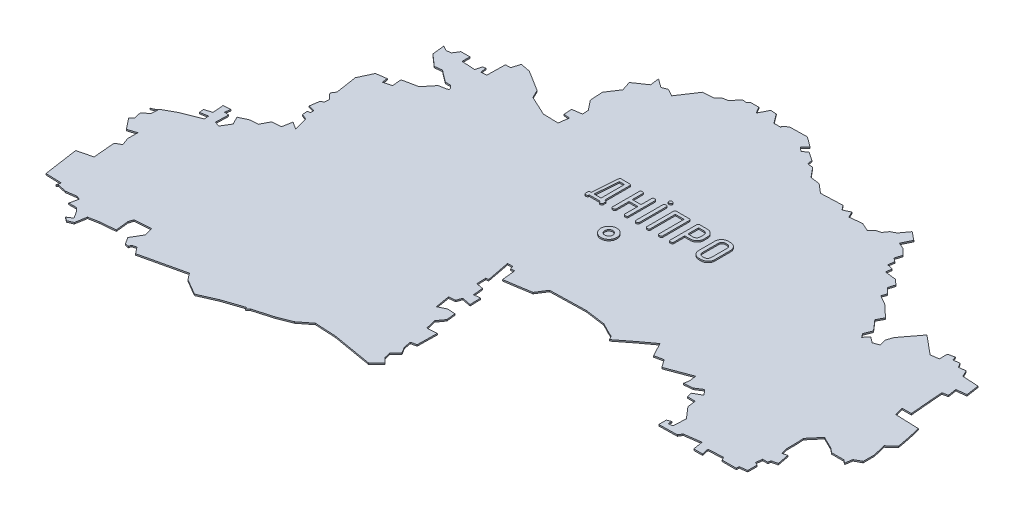
from build123d import *

# Parameters (mm, degrees)
EXTRUDE_4_DEPTH = 5
SKETCH_2_R      = 30
SKETCH_2_R_2    = 15
EXTRUDE_5_DEPTH = 10
SCALE_1_SCALE   = 0.05


with BuildPart() as part:
    # Эскиз1 → Бобышка-Вытянуть4 (new body)
    with BuildSketch(Plane(origin=(0, 0, 0), x_dir=(1, 0, 0), z_dir=(0, 1, 0))):
        with BuildLine():
            Line((2358.23506, -481.5078), (2348.5221, -465.28736))
            Line((2348.5221, -465.28736), (2324.4937, -467.88324))
            Line((2324.4937, -467.88324), (2319.32226, -454.24344))
            Line((2319.32226, -454.24344), (2295.29386, -459.4479))
            Line((2295.29386, -459.4479), (2295.29386, -489.94568))
            Line((2295.29386, -489.94568), (2264.80624, -493.85728))
            Line((2264.80624, -493.85728), (2194.68954, -435.44744))
            Line((2194.68954, -435.44744), (2141.4867, -505.52604))
            Line((2141.4867, -505.52604), (2133.05898, -530.83714))
            Line((2133.05898, -530.83714), (2140.19892, -554.8503))
            Line((2140.19892, -554.8503), (2118.14664, -563.27548))
            Line((2118.14664, -563.27548), (2095.41364, -546.40988))
            Line((2095.41364, -546.40988), (2080.51146, -565.24398))
            Line((2080.51146, -565.24398), (2070.1254, -551.58894))
            Line((2070.1254, -551.58894), (2081.78908, -522.38402))
            Line((2081.78908, -522.38402), (2048.03756, -483.46106))
            Line((2048.03756, -483.46106), (2061.69006, -457.50734))
            Line((2061.69006, -457.50734), (2016.87684, -415.31794))
            Line((2016.87684, -415.31794), (1981.21016, -394.56614))
            Line((1981.21016, -394.56614), (1988.36026, -375.7422))
            Line((1988.36026, -375.7422), (1967.5856, -354.95992))
            Line((1967.5856, -354.95992), (1974.7357, -331.61732))
            Line((1974.7357, -331.61732), (1955.90414, -314.0837))
            Line((1955.90414, -314.0837), (1913.06958, -308.9021))
            Line((1913.06958, -308.9021), (1916.3157, -286.83712))
            Line((1916.3157, -286.83712), (1894.23802, -281.6352))
            Line((1894.23802, -281.6352), (1897.4943, -258.2799))
            Line((1897.4943, -258.2799), (1883.89514, -247.90146))
            Line((1883.89514, -247.90146), (1892.30508, -221.93504))
            Line((1892.30508, -221.93504), (1868.94978, -199.88022))
            Line((1868.94978, -199.88022), (1846.24218, -189.50686))
            Line((1846.24218, -189.50686), (1863.78596, -153.80208))
            Line((1863.78596, -153.80208), (1832.58206, -128.49606))
            Line((1832.58206, -128.49606), (1809.23692, -160.93948))
            Line((1809.23692, -160.93948), (1790.41298, -170.67784))
            Line((1790.41298, -170.67784), (1778.04826, -188.19368))
            Line((1778.04826, -188.19368), (1759.29544, -193.39814))
            Line((1759.29544, -193.39814), (1744.36024, -208.31556))
            Line((1744.36024, -208.31556), (1713.19952, -194.68084))
            Line((1713.19952, -194.68084), (1667.14424, -199.88022))
            Line((1667.14424, -199.88022), (1656.73024, -177.80508))
            Line((1656.73024, -177.80508), (1631.40644, -189.50686))
            Line((1631.40644, -189.50686), (1617.80982, -172.62094))
            Line((1617.80982, -172.62094), (1537.32992, -175.84166))
            Line((1537.32992, -175.84166), (1503.60634, -147.32))
            Line((1503.60634, -147.32), (1467.89394, -142.1257))
            Line((1467.89394, -142.1257), (1438.70172, -106.43362))
            Line((1438.70172, -106.43362), (1417.94738, -104.46766))
            Line((1417.94738, -104.46766), (1414.6911, -85.67166))
            Line((1414.6911, -85.67166), (1382.20958, -63.61176))
            Line((1382.20958, -63.61176), (1365.37446, -77.22362))
            Line((1365.37446, -77.22362), (1349.79664, -63.61176))
            Line((1349.79664, -63.61176), (1366.67748, -44.79036))
            Line((1366.67748, -44.79036), (1329.65444, -17.51838))
            Line((1329.65444, -17.51838), (1264.78538, -18.83156))
            Line((1264.78538, -18.83156), (1247.28478, -31.79826))
            Line((1247.28478, -31.79826), (1249.21772, -36.34486))
            Line((1249.21772, -36.34486), (1223.24622, -36.34486))
            Line((1223.24622, -36.34486), (1197.93258, -1.95072))
            Line((1197.93258, -1.95072), (1175.88792, 0))
            Line((1175.88792, 0), (1157.06652, -36.34486))
            Line((1157.06652, -36.34486), (1143.42418, -12.34186))
            Line((1143.42418, -12.34186), (1112.91116, -12.34186))
            Line((1112.91116, -12.34186), (1102.54288, -20.7645))
            Line((1102.54288, -20.7645), (1088.91832, -18.83156))
            Line((1088.91832, -18.83156), (1064.89754, -48.02124))
            Line((1064.89754, -48.02124), (1044.16606, -51.25974))
            Line((1044.16606, -51.25974), (1029.25626, -66.8528))
            Line((1029.25626, -66.8528), (989.62464, -68.78828))
            Line((989.62464, -68.78828), (943.55412, -138.23188))
            Line((943.55412, -138.23188), (916.29484, -123.30684))
            Line((916.29484, -123.30684), (896.18566, -131.74218))
            Line((896.18566, -131.74218), (863.69652, -107.71886))
            Line((863.69652, -107.71886), (868.27106, -142.1257))
            Line((868.27106, -142.1257), (820.90514, -174.56404))
            Line((820.90514, -174.56404), (832.57136, -210.26628))
            Line((832.57136, -210.26628), (802.09136, -256.34696))
            Line((802.09136, -256.34696), (805.34764, -304.34788))
            Line((805.34764, -304.34788), (834.54748, -341.33536))
            Line((834.54748, -341.33536), (835.83272, -364.04804))
            Line((835.83272, -364.04804), (800.14064, -369.24234))
            Line((800.14064, -369.24234), (802.09136, -399.75028))
            Line((802.09136, -399.75028), (824.16142, -401.03298))
            Line((824.16142, -401.03298), (818.97982, -438.68086))
            Line((818.97982, -438.68086), (762.50546, -437.38038))
            Line((762.50546, -437.38038), (689.17566, -402.99386))
            Line((689.17566, -402.99386), (674.23792, -372.48846))
            Line((674.23792, -372.48846), (597.03208, -324.46976))
            Line((597.03208, -324.46976), (560.639888087, -317.514677457))
            Line((560.639888087, -317.514677457), (550.926, -348.48038))
            Line((550.926, -348.48038), (532.13762, -348.48038))
            Line((532.13762, -348.48038), (530.82444, -416.62096))
            Line((530.82444, -416.62096), (510.07772, -418.57168))
            Line((510.07772, -418.57168), (506.8316, -396.50416))
            Line((506.8316, -396.50416), (496.46078, -397.78686))
            Line((496.46078, -397.78686), (489.96092, -421.81018))
            Line((489.96092, -421.81018), (439.99404, -418.57168))
            Line((439.99404, -418.57168), (439.99404, -389.36422))
            Line((439.99404, -389.36422), (406.24252, -389.36422))
            Line((406.24252, -389.36422), (392.60272, -411.43174))
            Line((392.60272, -411.43174), (375.11736, -413.38246))
            Line((375.11736, -413.38246), (356.25278, -402.99386))
            Line((356.25278, -402.99386), (361.47502, -449.06692))
            Line((361.47502, -449.06692), (404.2918, -486.70972))
            Line((404.2918, -486.70972), (431.55108, -483.46106))
            Line((431.55108, -483.46106), (476.31858, -517.21766))
            Line((476.31858, -517.21766), (495.15776, -517.21766))
            add(Edge.make_bspline(
                [(495.15776, -517.21766), (518.50544, -534.73096), (495.15776, -537.96438)],
                knots=[0.34516129, 0.34516129, 0.34516129, 0.348387097, 0.348387097, 0.348387097], degree=2))
            add(Edge.make_bspline(
                [(495.15776, -537.96438), (471.13698, -541.24606), (472.44254, -543.18916)],
                knots=[0.348387097, 0.348387097, 0.348387097, 0.351612903, 0.351612903, 0.351612903], degree=2))
            Line((472.44254, -543.18916), (441.91936, -580.81672))
            Line((441.91936, -580.81672), (385.46024, -592.4804))
            Line((385.46024, -592.4804), (388.68858, -626.87454))
            Line((388.68858, -626.87454), (358.22128, -635.32766))
            Line((358.22128, -635.32766), (356.25278, -614.5403))
            Line((356.25278, -614.5403), (317.32982, -619.7346))
            Line((317.32982, -619.7346), (293.30904, -670.98164))
            Line((293.30904, -670.98164), (305.62042, -751.46916))
            Line((305.62042, -751.46916), (295.26992, -768.35508))
            Line((295.26992, -768.35508), (315.39688, -790.39974))
            Line((315.39688, -790.39974), (314.0837, -807.27042))
            Line((314.0837, -807.27042), (303.71288, -814.39512))
            Line((303.71288, -814.39512), (298.50588, -848.80958))
            Line((298.50588, -848.80958), (322.54444, -855.31706))
            Line((322.54444, -855.31706), (322.54444, -868.934))
            Line((322.54444, -868.934), (312.1406, -868.934))
            Line((312.1406, -868.934), (314.0837, -889.06096))
            Line((314.0837, -889.06096), (334.19034, -897.4963))
            Line((334.19034, -897.4963), (347.83522, -948.73826))
            Line((347.83522, -948.73826), (320.55054, -931.23004))
            Line((320.55054, -931.23004), (314.0837, -967.5876))
            Line((314.0837, -967.5876), (279.68448, -970.81594))
            Line((279.68448, -970.81594), (262.8392, -1003.23904))
            Line((262.8392, -1003.23904), (233.61396, -1004.5319))
            Line((233.61396, -1004.5319), (199.88784, -1020.1529))
            Line((199.88784, -1020.1529), (214.79002, -1049.32734))
            Line((214.79002, -1049.32734), (194.68084, -1083.05092))
            Line((194.68084, -1083.05092), (175.85944, -1076.58408))
            Line((175.85944, -1076.58408), (177.16246, -1028.56284))
            Line((177.16246, -1028.56284), (160.30194, -1027.27506))
            Line((160.30194, -1027.27506), (163.54806, -1006.51056))
            Line((163.54806, -1006.51056), (136.271, -1008.45366))
            Line((136.271, -1008.45366), (139.51712, -1049.32734))
            Line((139.51712, -1049.32734), (112.27816, -1057.79824))
            Line((112.27816, -1057.79824), (114.20348, -1074.65114))
            Line((114.20348, -1074.65114), (143.4211, -1069.46192))
            Line((143.4211, -1069.46192), (144.70634, -1086.97268))
            Line((144.70634, -1086.97268), (75.29068, -1114.2218))
            Line((75.29068, -1114.2218), (32.45612, -1138.23242))
            Line((32.45612, -1138.23242), (24.01062, -1146.66014))
            Line((24.01062, -1146.66014), (8.43534, -1153.16))
            Line((8.43534, -1153.16), (29.2354, -1144.74244))
            Line((29.2354, -1144.74244), (27.28468, -1168.72766))
            Line((27.28468, -1168.72766), (5.22478, -1187.55922))
            Line((5.22478, -1187.55922), (11.69924, -1214.79056))
            Line((11.69924, -1214.79056), (0, -1225.17662))
            Line((0, -1225.17662), (32.45612, -1266.06046))
            Line((32.45612, -1266.06046), (64.91224, -1255.66424))
            Line((64.91224, -1255.66424), (64.91224, -1293.33498))
            Line((64.91224, -1293.33498), (75.29068, -1322.54498))
            Line((75.29068, -1322.54498), (54.51602, -1334.19088))
            Line((54.51602, -1334.19088), (61.63818, -1415.9738))
            Line((61.63818, -1415.9738), (6.5024, -1429.61614))
            Line((6.5024, -1429.61614), (25.30602, -1559.3949))
            Line((25.30602, -1559.3949), (85.01126, -1561.32022))
            Line((85.01126, -1561.32022), (80.69707328, -1577.319718575))
            Line((80.69707328, -1577.319718575), (85.01126, -1573.02962))
            Line((85.01126, -1573.02962), (119.41048, -1580.17972))
            Line((119.41048, -1580.17972), (157.03804, -1574.97272))
            Line((157.03804, -1574.97272), (170.6626, -1580.17972))
            Line((170.6626, -1580.17972), (163.54806, -1612.61806))
            Line((163.54806, -1612.61806), (192.7479, -1612.61806))
            Line((192.7479, -1612.61806), (208.35112, -1629.47858))
            Line((208.35112, -1629.47858), (221.94774, -1651.54864))
            Line((221.94774, -1651.54864), (203.14412, -1663.9032))
            Line((203.14412, -1663.9032), (216.76868, -1673.60092))
            Line((216.76868, -1673.60092), (236.86008, -1665.16304))
            Line((236.86008, -1665.16304), (243.98986, -1622.98634))
            Line((243.98986, -1622.98634), (281.64536, -1615.85402))
            Line((281.64536, -1615.85402), (339.42528, -1610.68258))
            Line((339.42528, -1610.68258), (334.19034, -1562.64102))
            Line((334.19034, -1562.64102), (339.42528, -1544.47748))
            Line((339.42528, -1544.47748), (401.04568, -1540.53794))
            Line((401.04568, -1540.53794), (409.4734, -1573.02962))
            Line((409.4734, -1573.02962), (385.46024, -1613.9033))
            Line((385.46024, -1613.9033), (401.04568, -1637.9063))
            Line((401.04568, -1637.9063), (414.65246, -1641.1702))
            Line((414.65246, -1641.1702), (417.93414, -1631.41152))
            Line((417.93414, -1631.41152), (433.48402, -1627.55326))
            Line((433.48402, -1627.55326), (452.2978, -1651.54864))
            Line((452.2978, -1651.54864), (615.86364, -1613.9033))
            Line((615.86364, -1613.9033), (634.68504, -1637.9063))
            Line((634.68504, -1637.9063), (693.0517, -1672.33092))
            Line((693.0517, -1672.33092), (759.27712, -1643.06758))
            Line((759.27712, -1643.06758), (834.54748, -1617.8403))
            Line((834.54748, -1617.8403), (835.90885806, -1624.245126426))
            Line((835.90885806, -1624.245126426), (846.21116, -1615.85402))
            Line((846.21116, -1615.85402), (918.25572, -1595.08952))
            Line((918.25572, -1595.08952), (969.50784, -1574.97272))
            Line((969.50784, -1574.97272), (1013.61748, -1540.53794))
            Line((1013.61748, -1540.53794), (1092.18222, -1544.47748))
            Line((1092.18222, -1544.47748), (1240.7646, -1569.7835))
            Line((1240.7646, -1569.7835), (1273.24612, -1539.2781))
            Line((1273.24612, -1539.2781), (1254.40694, -1520.4567))
            Line((1254.40694, -1520.4567), (1249.21772, -1498.40442))
            Line((1249.21772, -1498.40442), (1271.27762, -1474.40142))
            Line((1271.27762, -1474.40142), (1257.63782, -1452.32374))
            Line((1257.63782, -1452.32374), (1252.45622, -1424.4193))
            Line((1252.45622, -1424.4193), (1273.24612, -1419.87778))
            Line((1273.24612, -1419.87778), (1274.52374, -1345.9079))
            Line((1274.52374, -1345.9079), (1237.52864, -1347.851))
            Line((1237.52864, -1347.851), (1228.44306, -1308.88486))
            Line((1228.44306, -1308.88486), (1247.28478, -1282.94892))
            Line((1247.28478, -1282.94892), (1245.95382, -1269.33198))
            Line((1245.95382, -1269.33198), (1243.99548, -1249.20756))
            Line((1243.99548, -1249.20756), (1214.81088, -1247.28224))
            Line((1214.81088, -1247.28224), (1186.25874, -1260.87124))
            Line((1186.25874, -1260.87124), (1177.1757, -1206.373))
            Line((1177.1757, -1206.373), (1201.1787, -1204.44006))
            Line((1201.1787, -1204.44006), (1208.31102, -1184.30294))
            Line((1208.31102, -1184.30294), (1242.07778, -1190.80534))
            Line((1242.07778, -1190.80534), (1240.7646, -1149.91388))
            Line((1240.7646, -1149.91388), (1216.74636, -1153.16))
            Line((1216.74636, -1153.16), (1213.51548, -1115.5426))
            Line((1213.51548, -1115.5426), (1187.57192, -1110.9833))
            Line((1187.57192, -1110.9833), (1186.25874, -1076.58408))
            Line((1186.25874, -1076.58408), (1195.97932, -1074.65114))
            Line((1195.97932, -1074.65114), (1179.1188, -987.68916))
            Line((1179.1188, -987.68916), (1197.93258, -987.68916))
            Line((1197.93258, -987.68916), (1203.12942, -1000.00816))
            Line((1203.12942, -1000.00816), (1216.74636, -998.06506))
            Line((1216.74636, -998.06506), (1221.93558, -1049.32734))
            Line((1221.93558, -1049.32734), (1269.3269, -1042.19502))
            Line((1269.3269, -1042.19502), (1320.57902, -1033.75968))
            Line((1320.57902, -1033.75968), (1344.57186, -996.11434))
            Line((1344.57186, -996.11434), (1479.5754, -992.86822))
            Line((1479.5754, -992.86822), (1554.84068, -1003.23904))
            Line((1554.84068, -1003.23904), (1587.31204, -1020.1529))
            Line((1587.31204, -1020.1529), (1609.3821, -1030.52118))
            Line((1609.3821, -1030.52118), (1615.86672, -1044.14574))
            Line((1615.86672, -1044.14574), (1672.33346, -1000.00816))
            Line((1672.33346, -1000.00816), (1723.57796, -962.36282))
            Line((1723.57796, -962.36282), (1750.85248, -1013.65812))
            Line((1750.85248, -1013.65812), (1783.24764, -1006.51056))
            Line((1783.24764, -1006.51056), (1804.06294, -1035.72056))
            Line((1804.06294, -1035.72056), (1896.19128, -1001.30356))
            Line((1896.19128, -1001.30356), (1899.44502, -1027.27506))
            Line((1899.44502, -1027.27506), (1896.19128, -1047.37408))
            Line((1896.19128, -1047.37408), (1929.98344, -1044.14574))
            Line((1929.98344, -1044.14574), (1955.90414, -1027.27506))
            Line((1955.90414, -1027.27506), (1972.75704, -1047.37408))
            Line((1972.75704, -1047.37408), (1942.2618, -1064.88484))
            Line((1942.2618, -1064.88484), (1947.4688, -1083.05092))
            Line((1947.4688, -1083.05092), (1976.02094, -1083.05092))
            Line((1976.02094, -1083.05092), (1979.92492, -1114.2218))
            Line((1979.92492, -1114.2218), (2016.87684, -1157.05382))
            Line((2016.87684, -1157.05382), (2013.64088, -1204.44006))
            Line((2013.64088, -1204.44006), (1998.10878, -1206.373))
            Line((1998.10878, -1206.373), (1998.10878, -1192.74844))
            Line((1998.10878, -1192.74844), (1983.15326, -1197.91988))
            Line((1983.15326, -1197.91988), (1983.15326, -1226.47202))
            Line((1983.15326, -1226.47202), (2051.31162, -1225.17662))
            Line((2051.31162, -1225.17662), (2059.74696, -1211.56984))
            Line((2059.74696, -1211.56984), (2121.36736, -1203.1345))
            Line((2121.36736, -1203.1345), (2127.87738, -1240.12452))
            Line((2127.87738, -1240.12452), (2160.3335, -1240.12452))
            Line((2160.3335, -1240.12452), (2155.10872, -1214.79056))
            Line((2155.10872, -1214.79056), (2210.29784, -1211.56984))
            Line((2210.29784, -1211.56984), (2216.77484, -1223.25384))
            Line((2216.77484, -1223.25384), (2270.02086, -1223.25384))
            Line((2270.02086, -1223.25384), (2270.02086, -1212.85762))
            Line((2270.02086, -1212.85762), (2298.53998, -1208.9892))
            Line((2298.53998, -1208.9892), (2298.53998, -1173.95244))
            Line((2298.53998, -1173.95244), (2286.86614, -1168.72766))
            Line((2286.86614, -1168.72766), (2290.10464, -1144.74244))
            Line((2290.10464, -1144.74244), (2308.90826, -1144.74244))
            Line((2308.90826, -1144.74244), (2310.85136, -1134.34622))
            Line((2310.85136, -1134.34622), (2332.94682, -1129.14938))
            Line((2332.94682, -1129.14938), (2324.4937, -1085.02958))
            Line((2324.4937, -1085.02958), (2306.97532, -1090.2188))
            Line((2306.97532, -1090.2188), (2300.52626, -1064.88484))
            Line((2300.52626, -1064.88484), (2300.52626, -1030.52118))
            Line((2300.52626, -1030.52118), (2298.53998, -1001.30356))
            Line((2298.53998, -1001.30356), (2334.87214, -958.47154))
            Line((2334.87214, -958.47154), (2380.95282, -981.1766))
            Line((2380.95282, -981.1766), (2397.80572, -994.81894))
            Line((2397.80572, -994.81894), (2443.8864, -994.81894))
            Line((2443.8864, -994.81894), (2455.62882, -1004.5319))
            Line((2455.62882, -1004.5319), (2459.48962, -977.28278))
            Line((2459.48962, -977.28278), (2484.77786, -963.68616))
            Line((2484.77786, -963.68616), (2484.77786, -921.4993))
            Line((2484.77786, -921.4993), (2473.13196, -874.12322))
            Line((2473.13196, -874.12322), (2501.6587, -848.80958))
            Line((2501.6587, -848.80958), (2491.9178, -797.54222))
            Line((2491.9178, -797.54222), (2481.55714, -754.71528))
            Line((2481.55714, -754.71528), (2394.56722, -751.46916))
            Line((2394.56722, -751.46916), (2385.49434, -719.03082))
            Line((2385.49434, -719.03082), (2419.92658, -719.03082))
            Line((2419.92658, -719.03082), (2413.41656, -643.72998))
            Line((2413.41656, -643.72998), (2409.51512, -594.41842))
            Line((2409.51512, -594.41842), (2430.26184, -590.54746))
            Line((2430.26184, -590.54746), (2425.07262, -558.09134))
            Line((2425.07262, -558.09134), (2462.7078, -553.54474))
            Line((2462.7078, -553.54474), (2455.62882, -505.52604))
            Line((2455.62882, -505.52604), (2395.89056, -502.26722))
            Line((2395.89056, -502.26722), (2384.21672, -478.23374))
            Line((2384.21672, -478.23374), (2358.23506, -481.5078))
        make_face()
    extrude(amount=EXTRUDE_4_DEPTH)

    # Эскиз2 → Бобышка-Вытянуть5 (add)
    # profile 1 of 8: a face of its own
    with BuildSketch(Plane(origin=(0, 0, 0), x_dir=(1, 0, 0), z_dir=(0, 1, 0))):
        with Locations((1274.370708345, -704.402905574)):
            Circle(SKETCH_2_R)
        with Locations((1274.370708345, -704.402905574)):
            Circle(SKETCH_2_R_2, mode=Mode.SUBTRACT)
    # profile 2 of 8: a face of its own
    with BuildSketch(Plane(origin=(0, 0, 0), x_dir=(1, 0, 0), z_dir=(0, 1, 0))):
        with BuildLine():
            add(Edge.make_bspline(
                [(1168.34409001, -619.015856633), (1168.320924518, -619.428047826), (1168.277376409, -620.202913584), (1167.974758725, -621.299724988), (1167.426392999, -622.223951417), (1166.665076071, -622.99275006), (1165.662730078, -623.55058371), (1164.478515906, -623.967179941), (1163.071531143, -624.185001608), (1162.073612619, -624.221971393), (1161.538769064, -624.241785687)],
                knots=[0, 0, 0, 0, 1.011223658, 1.900968769, 2.761019817, 3.620651225, 4.523080298, 5.550410921, 6.687120342, 8, 8, 8, 8], degree=3))
            add(Edge.make_bspline(
                [(1161.538769064, -624.241785687), (1161.127425316, -624.230246119), (1160.352878561, -624.208517493), (1159.269804198, -624.001431894), (1158.343054939, -623.657551317), (1157.576154908, -623.162167793), (1156.969703803, -622.512224857), (1156.551636803, -621.709637221), (1156.323660825, -620.769957738), (1156.286196981, -620.10873379), (1156.266387308, -619.759099876)],
                knots=[0, 0, 0, 0, 1.24640066, 2.346931468, 3.328022477, 4.226704364, 5.090670078, 5.993941009, 6.939260654, 8, 8, 8, 8], degree=3))
            Line((1156.266387308, -619.759099876), (1156.266387308, -618.295839741))
            Line((1156.266387308, -618.295839741), (1114.575086632, -618.295839741))
            Line((1114.575086632, -618.295839741), (1114.575086632, -619.759099876))
            add(Edge.make_bspline(
                [(1114.575086632, -619.759099876), (1114.55136682, -620.109751645), (1114.506110383, -620.778780977), (1114.197843605, -621.729363726), (1113.652515931, -622.535717179), (1112.868555123, -623.184676414), (1111.876437799, -623.658340413), (1110.685394413, -624.007896954), (1109.286111379, -624.207576435), (1108.281398313, -624.229901134), (1107.746539335, -624.241785687)],
                knots=[0, 0, 0, 0, 0.90963295, 1.735542724, 2.560229832, 3.401392929, 4.344787885, 5.393539172, 6.612450636, 8, 8, 8, 8], degree=3))
            add(Edge.make_bspline(
                [(1107.746539335, -624.241785687), (1107.327846618, -624.221021397), (1106.537596952, -624.181830429), (1105.424601014, -623.971281424), (1104.498423134, -623.537186921), (1103.717103171, -622.964565876), (1103.104488967, -622.208272071), (1102.685897464, -621.280036754), (1102.459950536, -620.195495778), (1102.42382494, -619.427267511), (1102.404478524, -619.015856633)],
                knots=[0, 0, 0, 0, 1.175256394, 2.218204275, 3.15048955, 4.018671257, 4.913572477, 5.845857752, 6.846387733, 8, 8, 8, 8], degree=3))
            Line((1102.404478524, -619.015856633), (1102.404478524, -611.629876903))
            add(Edge.make_bspline(
                [(1102.404478524, -611.629876903), (1102.42382494, -611.218466025), (1102.459950536, -610.450237757), (1102.685897464, -609.365696782), (1103.104488967, -608.437461464), (1103.717103171, -607.68116766), (1104.498423134, -607.108546615), (1105.424601014, -606.674452111), (1106.537596952, -606.463903107), (1107.327846618, -606.424712138), (1107.746539335, -606.403947849)],
                knots=[0, 0, 0, 0, 1.153612267, 2.154142248, 3.086427523, 3.981328743, 4.84951045, 5.781795725, 6.824743606, 8, 8, 8, 8], degree=3))
            Line((1107.746539335, -606.403947849), (1110.440796091, -606.403947849))
            Line((1110.440796091, -606.403947849), (1117.80354947, -511.733339741))
            add(Edge.make_bspline(
                [(1117.80354947, -511.733339741), (1117.855992817, -511.344885718), (1117.954961763, -510.611811127), (1118.241727105, -509.583416212), (1118.727060833, -508.738258873), (1119.307066054, -508.005465572), (1120.081711375, -507.471960584), (1120.969895249, -507.074650303), (1122.003161444, -506.836128881), (1122.733949055, -506.818645944), (1123.122383929, -506.809353254)],
                knots=[0, 0, 0, 0, 1.153876531, 2.177548735, 3.116003306, 4.005891104, 4.903911204, 5.852547225, 6.858566379, 8, 8, 8, 8], degree=3))
            Line((1123.122383929, -506.809353254), (1153.990204875, -506.809353254))
            add(Edge.make_bspline(
                [(1153.990204875, -506.809353254), (1154.517252466, -506.829709246), (1155.507312864, -506.867948035), (1156.899800559, -507.081072123), (1158.08002374, -507.502005954), (1159.063147081, -508.077166271), (1159.815316088, -508.86082195), (1160.35658906, -509.799198649), (1160.658943589, -510.918252411), (1160.702628152, -511.708282081), (1160.725846767, -512.128187714)],
                knots=[0, 0, 0, 0, 1.29179243, 2.42663575, 3.434416577, 4.345091539, 5.190008446, 6.065035692, 6.971554559, 8, 8, 8, 8], degree=3))
            Line((1160.725846767, -512.128187714), (1160.725846767, -606.403947849))
            Line((1160.725846767, -606.403947849), (1161.538769064, -606.403947849))
            add(Edge.make_bspline(
                [(1161.538769064, -606.403947849), (1162.073612619, -606.423762143), (1163.071531143, -606.460731927), (1164.478515906, -606.678553594), (1165.662730078, -607.095149825), (1166.665076071, -607.652983476), (1167.426392999, -608.421782119), (1167.974758725, -609.346008548), (1168.277376409, -610.442819951), (1168.320924518, -611.217685709), (1168.34409001, -611.629876903)],
                knots=[0, 0, 0, 0, 1.312879658, 2.449589079, 3.476919702, 4.379348775, 5.238980183, 6.099031231, 6.988776342, 8, 8, 8, 8], degree=3))
            Line((1168.34409001, -611.629876903), (1168.34409001, -619.015856633))
        make_face()
        Polygon((1147.347468389, -606.403947849), (1147.347468389, -518.701245146), (1128.185728524, -518.701245146), (1121.264275821, -606.403947849), align=None, mode=Mode.SUBTRACT)
    # profile 3 of 8: a face of its own
    with BuildSketch(Plane(origin=(0, 0, 0), x_dir=(1, 0, 0), z_dir=(0, 1, 0))):
        with BuildLine():
            Line((1243.374495416, -552.890434335), (1243.374495416, -513.498542443))
            add(Edge.make_bspline(
                [(1243.374495416, -513.498542443), (1243.388904396, -513.086038984), (1243.415939029, -512.312085596), (1243.706598262, -511.230981208), (1244.161326911, -510.301883054), (1244.850264708, -509.55991652), (1245.698067594, -508.960411471), (1246.75778437, -508.585137745), (1247.975069982, -508.314383167), (1248.854066138, -508.30226785), (1249.320441362, -508.295839741)],
                knots=[0, 0, 0, 0, 1.091529518, 2.047965782, 2.948064081, 3.805939007, 4.706037306, 5.674741692, 6.76627121, 8, 8, 8, 8], degree=3))
            add(Edge.make_bspline(
                [(1249.320441362, -508.295839741), (1249.901676865, -508.316139073), (1250.991853018, -508.354212879), (1252.521291219, -508.566784576), (1253.819280698, -508.983253143), (1254.893876217, -509.564062487), (1255.748463652, -510.326879892), (1256.330810396, -511.282694639), (1256.699538667, -512.396329729), (1256.734432653, -513.193419695), (1256.752873794, -513.6146742)],
                knots=[0, 0, 0, 0, 1.342902474, 2.518772933, 3.553495682, 4.473922706, 5.321854953, 6.165250748, 7.030352379, 8, 8, 8, 8], degree=3))
            Line((1256.752873794, -513.6146742), (1256.752873794, -612.977005281))
            add(Edge.make_bspline(
                [(1256.752873794, -612.977005281), (1256.734432653, -613.398259787), (1256.699538667, -614.195349753), (1256.330810396, -615.308984842), (1255.748463652, -616.264799589), (1254.893876217, -617.027616994), (1253.819280698, -617.608426339), (1252.521291219, -618.024894906), (1250.991853018, -618.237466602), (1249.901676865, -618.275540408), (1249.320441362, -618.295839741)],
                knots=[0, 0, 0, 0, 0.969647621, 1.834749252, 2.678145047, 3.526077294, 4.446504318, 5.481227067, 6.657097526, 8, 8, 8, 8], degree=3))
            add(Edge.make_bspline(
                [(1249.320441362, -618.295839741), (1248.855182938, -618.27556219), (1247.980221613, -618.237428387), (1246.748463429, -618.02215062), (1245.704518928, -617.599980457), (1244.84131511, -617.010587429), (1244.161858898, -616.239827602), (1243.706253558, -615.29067631), (1243.416239462, -614.186151707), (1243.389000176, -613.397146125), (1243.374495416, -612.977005281)],
                knots=[0, 0, 0, 0, 1.22289028, 2.299757822, 3.266537475, 4.157864275, 5.022578284, 5.932048079, 6.898827733, 8, 8, 8, 8], degree=3))
            Line((1243.374495416, -612.977005281), (1243.374495416, -564.782326227))
            Line((1243.374495416, -564.782326227), (1210.671792713, -564.782326227))
            Line((1210.671792713, -564.782326227), (1210.671792713, -612.977005281))
            add(Edge.make_bspline(
                [(1210.671792713, -612.977005281), (1210.653351572, -613.398259787), (1210.618457586, -614.195349753), (1210.249729314, -615.308984842), (1209.667382571, -616.264799589), (1208.812795136, -617.027616994), (1207.738199617, -617.608426339), (1206.440210138, -618.024894906), (1204.910771937, -618.237466602), (1203.820595784, -618.275540408), (1203.239360281, -618.295839741)],
                knots=[0, 0, 0, 0, 0.969647621, 1.834749252, 2.678145047, 3.526077294, 4.446504318, 5.481227067, 6.657097526, 8, 8, 8, 8], degree=3))
            add(Edge.make_bspline(
                [(1203.239360281, -618.295839741), (1202.774101857, -618.27556219), (1201.899140532, -618.237428387), (1200.667382348, -618.02215062), (1199.623437847, -617.599980457), (1198.760234029, -617.010587429), (1198.080777817, -616.239827602), (1197.625172477, -615.29067631), (1197.335158381, -614.186151707), (1197.307919095, -613.397146125), (1197.293414335, -612.977005281)],
                knots=[0, 0, 0, 0, 1.22289028, 2.299757822, 3.266537475, 4.157864275, 5.022578284, 5.932048079, 6.898827733, 8, 8, 8, 8], degree=3))
            Line((1197.293414335, -612.977005281), (1197.293414335, -513.6146742))
            add(Edge.make_bspline(
                [(1197.293414335, -513.6146742), (1197.307919095, -513.194533356), (1197.335158381, -512.405527774), (1197.625172477, -511.301003172), (1198.080777817, -510.351851879), (1198.760234029, -509.581092053), (1199.623437847, -508.991699025), (1200.667382348, -508.569528862), (1201.899140532, -508.354251094), (1202.774101857, -508.316117292), (1203.239360281, -508.295839741)],
                knots=[0, 0, 0, 0, 1.101172267, 2.067951921, 2.977421716, 3.842135725, 4.733462525, 5.700242178, 6.77710972, 8, 8, 8, 8], degree=3))
            add(Edge.make_bspline(
                [(1203.239360281, -508.295839741), (1203.821544391, -508.302077641), (1204.91505322, -508.313794207), (1206.432333119, -508.583517153), (1207.743829354, -508.951162798), (1208.804122958, -509.544592302), (1209.666888839, -510.277027819), (1210.249164233, -511.212303904), (1210.618733306, -512.302714434), (1210.653439585, -513.084908254), (1210.671792713, -513.498542443)],
                knots=[0, 0, 0, 0, 1.353106154, 2.541521659, 3.579288285, 4.507284885, 5.350131461, 6.185231121, 7.040326791, 8, 8, 8, 8], degree=3))
            Line((1210.671792713, -513.498542443), (1210.671792713, -552.890434335))
            Line((1210.671792713, -552.890434335), (1243.374495416, -552.890434335))
        make_face()
    # profile 4 of 8: a face of its own
    with BuildSketch(Plane(origin=(0, 0, 0), x_dir=(1, 0, 0), z_dir=(0, 1, 0))):
        with BuildLine():
            add(Edge.make_bspline(
                [(1297.779900821, -612.95377893), (1297.759936522, -613.37446623), (1297.721810091, -614.177865614), (1297.369779113, -615.299245601), (1296.767551433, -616.245258116), (1295.915763636, -617.001641993), (1294.853637046, -617.614129881), (1293.547142474, -618.022695067), (1292.019240976, -618.238141894), (1290.928829406, -618.275775242), (1290.347468389, -618.295839741)],
                knots=[0, 0, 0, 0, 0.968349646, 1.849286893, 2.676465977, 3.523263178, 4.451261044, 5.484598709, 6.658895142, 8, 8, 8, 8], degree=3))
            add(Edge.make_bspline(
                [(1290.347468389, -618.295839741), (1289.882082892, -618.275747936), (1289.006882594, -618.237963446), (1287.776699981, -618.020382626), (1286.72343905, -617.604028466), (1285.874497328, -616.985518224), (1285.195512908, -616.221941514), (1284.722999636, -615.279097552), (1284.447396918, -614.169295918), (1284.417363968, -613.373525277), (1284.401522443, -612.95377893)],
                knots=[0, 0, 0, 0, 1.220860227, 2.29594012, 3.261114875, 4.162696787, 5.025975332, 5.915822489, 6.900655729, 8, 8, 8, 8], degree=3))
            Line((1284.401522443, -612.95377893), (1284.401522443, -512.941110011))
            add(Edge.make_bspline(
                [(1284.401522443, -512.941110011), (1284.41753976, -512.521531969), (1284.447905983, -511.726080405), (1284.721279484, -510.614144505), (1285.20391666, -509.673155262), (1285.858670003, -508.883903504), (1286.732952094, -508.296004815), (1287.775054982, -507.872398792), (1289.00738043, -507.657563307), (1289.882255716, -507.619362422), (1290.347468389, -507.5990492)],
                knots=[0, 0, 0, 0, 1.098843442, 2.08322802, 2.972669788, 3.850929026, 4.740370794, 5.705105844, 6.779695961, 8, 8, 8, 8], degree=3))
            add(Edge.make_bspline(
                [(1290.347468389, -507.5990492), (1290.928645311, -507.619404934), (1292.018711589, -507.657584528), (1293.548867011, -507.869465687), (1294.844598809, -508.288107937), (1295.93103761, -508.86452598), (1296.759470331, -509.651291811), (1297.371243632, -510.593914258), (1297.721390728, -511.717518446), (1297.759792398, -512.520592871), (1297.779900821, -512.941110011)],
                knots=[0, 0, 0, 0, 1.340544031, 2.514349394, 3.547254935, 4.466065479, 5.324653274, 6.151486447, 7.032055301, 8, 8, 8, 8], degree=3))
            Line((1297.779900821, -512.941110011), (1297.779900821, -612.95377893))
        make_face()
    # profile 5 of 8: a face of its own
    with BuildSketch(Plane(origin=(0, 0, 0), x_dir=(1, 0, 0), z_dir=(0, 1, 0))):
        with BuildLine():
            add(Edge.make_bspline(
                [(1290.347468389, -484.512055957), (1290.928703892, -484.532355289), (1292.018880045, -484.570429096), (1293.548318246, -484.783000792), (1294.846307725, -485.199469359), (1295.920903244, -485.780278704), (1296.775490679, -486.543096108), (1297.357837423, -487.498910855), (1297.726565694, -488.612545945), (1297.76145968, -489.409635911), (1297.779900821, -489.830890416)],
                knots=[0, 0, 0, 0, 1.342902474, 2.518772933, 3.553495682, 4.473922706, 5.321854953, 6.165250748, 7.030352379, 8, 8, 8, 8], degree=3))
            add(Edge.make_bspline(
                [(1297.779900821, -489.830890416), (1297.76094014, -490.259518152), (1297.725041373, -491.071050536), (1297.364742866, -492.204807854), (1296.767780039, -493.164870061), (1295.929963191, -493.952927733), (1294.845169023, -494.53210674), (1293.546446931, -494.94227415), (1292.021438636, -495.193104952), (1290.929164152, -495.225420493), (1290.347468389, -495.242630281)],
                knots=[0, 0, 0, 0, 0.981339183, 1.857995784, 2.696169867, 3.550943068, 4.465671455, 5.493987931, 6.665411832, 8, 8, 8, 8], degree=3))
            add(Edge.make_bspline(
                [(1290.347468389, -495.242630281), (1289.881631081, -495.225369499), (1289.004047875, -495.192852196), (1287.777992924, -494.939496375), (1286.732391145, -494.524216455), (1285.859523505, -493.933746521), (1285.196557176, -493.141463375), (1284.727200438, -492.185707557), (1284.444762196, -491.062210324), (1284.416538146, -490.258486167), (1284.401522443, -489.830890416)],
                knots=[0, 0, 0, 0, 1.213876563, 2.286801999, 3.246455683, 4.131212664, 5.004846013, 5.90761226, 6.886811976, 8, 8, 8, 8], degree=3))
            add(Edge.make_bspline(
                [(1284.401522443, -489.830890416), (1284.416027203, -489.410749572), (1284.443266489, -488.62174399), (1284.733280585, -487.517219388), (1285.188885925, -486.568068095), (1285.868342137, -485.797308269), (1286.731545955, -485.207915241), (1287.775490456, -484.785745078), (1289.00724864, -484.57046731), (1289.882209965, -484.532333508), (1290.347468389, -484.512055957)],
                knots=[0, 0, 0, 0, 1.101172267, 2.067951921, 2.977421716, 3.842135725, 4.733462525, 5.700242178, 6.77710972, 8, 8, 8, 8], degree=3))
        make_face()
    # profile 6 of 8: a face of its own
    with BuildSketch(Plane(origin=(0, 0, 0), x_dir=(1, 0, 0), z_dir=(0, 1, 0))):
        with BuildLine():
            add(Edge.make_bspline(
                [(1384.888008929, -612.977005281), (1384.869567788, -613.398259787), (1384.834673802, -614.195349753), (1384.465945531, -615.308984842), (1383.883598787, -616.264799589), (1383.029011352, -617.027616994), (1381.954415833, -617.608426339), (1380.656426354, -618.024894906), (1379.126988153, -618.237466602), (1378.036812, -618.275540408), (1377.455576497, -618.295839741)],
                knots=[0, 0, 0, 0, 0.969647621, 1.834749252, 2.678145047, 3.526077294, 4.446504318, 5.481227067, 6.657097526, 8, 8, 8, 8], degree=3))
            add(Edge.make_bspline(
                [(1377.455576497, -618.295839741), (1376.990286278, -618.275592908), (1376.11526516, -618.237516874), (1374.883901201, -618.021858234), (1373.838676856, -617.600924564), (1372.984548004, -617.010709318), (1372.297020867, -616.265888393), (1371.836913205, -615.331213339), (1371.554130083, -614.23990912), (1371.525004761, -613.458933359), (1371.509630551, -613.046684335)],
                knots=[0, 0, 0, 0, 1.231142298, 2.315276502, 3.288579949, 4.185921389, 5.041168779, 5.938510218, 6.911813665, 8, 8, 8, 8], degree=3))
            Line((1371.509630551, -613.046684335), (1371.509630551, -520.187731633))
            Line((1371.509630551, -520.187731633), (1338.806927848, -520.187731633))
            Line((1338.806927848, -520.187731633), (1338.806927848, -613.046684335))
            add(Edge.make_bspline(
                [(1338.806927848, -613.046684335), (1338.787445394, -613.459958067), (1338.750255962, -614.248843043), (1338.390105549, -615.350542284), (1337.801396765, -616.290769654), (1336.9399634, -617.02588992), (1335.874403166, -617.609755025), (1334.575002185, -618.02446824), (1333.046012391, -618.237597577), (1331.955767544, -618.275585955), (1331.374495416, -618.295839741)],
                knots=[0, 0, 0, 0, 0.957214147, 1.827195396, 2.6601552, 3.500842069, 4.426460774, 5.467019893, 6.649522866, 8, 8, 8, 8], degree=3))
            add(Edge.make_bspline(
                [(1331.374495416, -618.295839741), (1330.909236992, -618.27556219), (1330.034275667, -618.237428387), (1328.802517483, -618.02215062), (1327.758572982, -617.599980457), (1326.895369164, -617.010587429), (1326.215912952, -616.239827602), (1325.760307612, -615.29067631), (1325.470293516, -614.186151707), (1325.44305423, -613.397146125), (1325.42854947, -612.977005281)],
                knots=[0, 0, 0, 0, 1.22289028, 2.299757822, 3.266537475, 4.157864275, 5.022578284, 5.932048079, 6.898827733, 8, 8, 8, 8], degree=3))
            Line((1325.42854947, -612.977005281), (1325.42854947, -513.6146742))
            add(Edge.make_bspline(
                [(1325.42854947, -513.6146742), (1325.444931412, -513.194875522), (1325.475622587, -512.408392746), (1325.739587801, -511.307853057), (1326.146059883, -510.364585147), (1326.749406986, -509.583473878), (1327.540989126, -508.998605478), (1328.489788743, -508.571693061), (1329.615256116, -508.353001185), (1330.413652492, -508.315747102), (1330.840289335, -508.295839741)],
                knots=[0, 0, 0, 0, 1.157077194, 2.167756429, 3.10506564, 3.97280776, 4.857486845, 5.794796055, 6.821611322, 8, 8, 8, 8], degree=3))
            Line((1330.840289335, -508.295839741), (1377.989782578, -508.295839741))
            add(Edge.make_bspline(
                [(1377.989782578, -508.295839741), (1378.532346732, -508.315864885), (1379.545612864, -508.353262859), (1380.968284322, -508.567903372), (1382.172046155, -508.988244179), (1383.174987176, -509.564153732), (1383.957038449, -510.338644576), (1384.48820069, -511.29071672), (1384.829523921, -512.399850149), (1384.867748333, -513.193830299), (1384.888008929, -513.6146742)],
                knots=[0, 0, 0, 0, 1.311732788, 2.449727646, 3.461545579, 4.37596936, 5.222620336, 6.085851813, 6.985418475, 8, 8, 8, 8], degree=3))
            Line((1384.888008929, -513.6146742), (1384.888008929, -612.977005281))
        make_face()
    # profile 7 of 8: a face of its own
    with BuildSketch(Plane(origin=(0, 0, 0), x_dir=(1, 0, 0), z_dir=(0, 1, 0))):
        with BuildLine():
            Line((1425.915035956, -572.21475866), (1425.915035956, -612.977005281))
            add(Edge.make_bspline(
                [(1425.915035956, -612.977005281), (1425.896594815, -613.398259787), (1425.861700829, -614.195349753), (1425.492972558, -615.308984842), (1424.910625814, -616.264799589), (1424.056038379, -617.027616994), (1422.98144286, -617.608426339), (1421.683453381, -618.024894906), (1420.15401518, -618.237466602), (1419.063839027, -618.275540408), (1418.482603524, -618.295839741)],
                knots=[0, 0, 0, 0, 0.969647621, 1.834749252, 2.678145047, 3.526077294, 4.446504318, 5.481227067, 6.657097526, 8, 8, 8, 8], degree=3))
            add(Edge.make_bspline(
                [(1418.482603524, -618.295839741), (1418.0173451, -618.27556219), (1417.142383775, -618.237428387), (1415.910625592, -618.02215062), (1414.86668109, -617.599980457), (1414.003477272, -617.010587429), (1413.32402106, -616.239827602), (1412.86841572, -615.29067631), (1412.578401624, -614.186151707), (1412.551162338, -613.397146125), (1412.536657578, -612.977005281)],
                knots=[0, 0, 0, 0, 1.22289028, 2.299757822, 3.266537475, 4.157864275, 5.022578284, 5.932048079, 6.898827733, 8, 8, 8, 8], degree=3))
            Line((1412.536657578, -612.977005281), (1412.536657578, -513.6146742))
            add(Edge.make_bspline(
                [(1412.536657578, -513.6146742), (1412.55303952, -513.194875522), (1412.583730695, -512.408392746), (1412.84769591, -511.307853057), (1413.254167991, -510.364585147), (1413.857515094, -509.583473878), (1414.649097234, -508.998605478), (1415.597896851, -508.571693061), (1416.723364224, -508.353001185), (1417.5217606, -508.315747102), (1417.948397443, -508.295839741)],
                knots=[0, 0, 0, 0, 1.157077194, 2.167756429, 3.10506564, 3.97280776, 4.857486845, 5.794796055, 6.821611322, 8, 8, 8, 8], degree=3))
            Line((1417.948397443, -508.295839741), (1445.40194474, -508.295839741))
            add(Edge.make_bspline(
                [(1445.40194474, -508.295839741), (1446.332399132, -508.315979763), (1448.153631215, -508.355400991), (1450.823284413, -508.729370465), (1453.385638775, -509.257188511), (1455.814165583, -510.102516476), (1458.154158399, -511.099366142), (1460.339258915, -512.412282824), (1462.44523023, -513.882693427), (1464.37023343, -515.609556666), (1466.155447815, -517.444969908), (1467.709586974, -519.391201146), (1469.026747503, -521.416259401), (1470.126019715, -523.500674195), (1470.972376338, -525.674497989), (1471.540912095, -527.931076678), (1471.93751865, -530.246307337), (1471.976529862, -531.822458442), (1471.996117037, -532.613829606)],
                knots=[0, 0, 0, 0, 1.115359705, 2.183157925, 3.228715987, 4.24774915, 5.262329495, 6.273717254, 7.299288291, 8.338890594, 9.370038504, 10.367862649, 11.320905581, 12.263804873, 13.189908176, 14.111156383, 15.051628764, 16, 16, 16, 16], degree=3))
            Line((1471.996117037, -532.613829606), (1471.996117037, -547.966447849))
            add(Edge.make_bspline(
                [(1471.996117037, -547.966447849), (1471.974328215, -548.757458081), (1471.931175702, -550.324044772), (1471.570074388, -552.63596845), (1470.990331669, -554.878416548), (1470.16982184, -557.049135578), (1469.125710134, -559.147120063), (1467.823331276, -561.157306534), (1466.321664031, -563.11267345), (1464.578889363, -564.945285087), (1462.708454474, -566.674202319), (1460.641298443, -568.122100262), (1458.497295786, -569.406887242), (1456.204483322, -570.41451399), (1453.81044631, -571.24837277), (1451.281047775, -571.784618718), (1448.649009046, -572.153528751), (1446.851061668, -572.194108886), (1445.936150821, -572.21475866)],
                knots=[0, 0, 0, 0, 0.959067182, 1.899421552, 2.831059805, 3.764258791, 4.709244439, 5.667943704, 6.665417502, 7.695258647, 8.732566372, 9.748959613, 10.750800674, 11.759659972, 12.7812896, 13.820296438, 14.890827142, 16, 16, 16, 16], degree=3))
            Line((1445.936150821, -572.21475866), (1425.915035956, -572.21475866))
        make_face()
        with BuildLine():
            Line((1425.915035956, -560.322866768), (1445.192907578, -560.322866768))
            add(Edge.make_bspline(
                [(1445.192907578, -560.322866768), (1446.081042592, -560.282850487), (1447.826286834, -560.204215839), (1450.323247657, -559.443827477), (1452.639092514, -558.26031941), (1454.688346019, -556.619605458), (1456.433862036, -554.67983264), (1457.696960457, -552.463115344), (1458.471234528, -550.053149756), (1458.568506719, -548.374669107), (1458.617738659, -547.525147173)],
                knots=[0, 0, 0, 0, 1.033886494, 2.031655573, 3.017574438, 4.053235711, 5.077365722, 6.044435782, 7.010238993, 8, 8, 8, 8], degree=3))
            Line((1458.617738659, -547.525147173), (1458.617738659, -533.055130281))
            add(Edge.make_bspline(
                [(1458.617738659, -533.055130281), (1458.567929178, -532.205945165), (1458.469515886, -530.52813), (1457.702464463, -528.109541439), (1456.400763932, -525.903917784), (1454.669596991, -523.945731722), (1452.63353152, -522.261993246), (1450.31615073, -521.074450083), (1447.819617451, -520.303456104), (1446.081305275, -520.226871606), (1445.192907578, -520.187731633)],
                knots=[0, 0, 0, 0, 0.988107596, 1.952297418, 2.922249424, 3.951448995, 4.983962972, 5.98039188, 6.967840629, 8, 8, 8, 8], degree=3))
            Line((1445.192907578, -520.187731633), (1425.915035956, -520.187731633))
            Line((1425.915035956, -520.187731633), (1425.915035956, -560.322866768))
        make_face(mode=Mode.SUBTRACT)
    # profile 8 of 8: a face of its own
    with BuildSketch(Plane(origin=(0, 0, 0), x_dir=(1, 0, 0), z_dir=(0, 1, 0))):
        with BuildLine():
            add(Edge.make_bspline(
                [(1559.104225146, -593.88494447), (1559.081656617, -594.68348531), (1559.036957825, -596.265059866), (1558.688025531, -598.597514711), (1558.067621918, -600.849762725), (1557.23844421, -603.033603349), (1556.155621516, -605.139037065), (1554.846114334, -607.16688665), (1553.303919778, -609.131300775), (1551.531820645, -610.981319798), (1549.599022322, -612.708165123), (1547.49407441, -614.179773196), (1545.308455965, -615.491619734), (1542.962766752, -616.494469657), (1540.523188765, -617.329892826), (1537.947463852, -617.865519363), (1535.269189557, -618.234589006), (1533.440429282, -618.275186092), (1532.510052848, -618.295839741)],
                knots=[0, 0, 0, 0, 0.955175484, 1.891802106, 2.813050817, 3.745408234, 4.681622557, 5.639981446, 6.629481268, 7.664661711, 8.701581189, 9.72450561, 10.733283354, 11.745245447, 12.770431959, 13.813291825, 14.887518622, 16, 16, 16, 16], degree=3))
            Line((1532.510052848, -618.295839741), (1524.659546091, -618.295839741))
            add(Edge.make_bspline(
                [(1524.659546091, -618.295839741), (1523.814603609, -618.272349904), (1522.149385159, -618.226055972), (1519.69097366, -617.893427301), (1517.321972694, -617.345443729), (1515.056286765, -616.540703425), (1512.878335112, -615.54441582), (1510.809975769, -614.299794952), (1508.820206593, -612.854970786), (1506.959960614, -611.191809766), (1505.250703483, -609.377813924), (1503.760646551, -607.433934948), (1502.463728141, -605.419238073), (1501.450064813, -603.279722202), (1500.614853877, -601.072487611), (1500.076689807, -598.751284293), (1499.706661103, -596.351067422), (1499.665593897, -594.714810896), (1499.644765686, -593.88494447)],
                knots=[0, 0, 0, 0, 1.043149238, 2.055845687, 3.05760797, 4.040256608, 5.019784463, 6.010076682, 7.015890737, 8.051962927, 9.086799385, 10.08878973, 11.072786086, 12.039115508, 13.007004251, 13.980870723, 14.97595055, 16, 16, 16, 16], degree=3))
            Line((1499.644765686, -593.88494447), (1499.644765686, -532.706735011))
            add(Edge.make_bspline(
                [(1499.644765686, -532.706735011), (1499.665788213, -531.876915708), (1499.707238554, -530.240752095), (1500.073336141, -527.847309147), (1500.619186638, -525.535763788), (1501.449613404, -523.335069809), (1502.463872725, -521.195728716), (1503.760524801, -519.180839319), (1505.251053527, -517.237571273), (1506.95864035, -515.421249889), (1508.82850082, -513.763693907), (1510.805354307, -512.28132821), (1512.898819624, -511.055403977), (1515.07853443, -510.049147604), (1517.338698639, -509.250757457), (1519.697885039, -508.694980883), (1522.149533638, -508.366213057), (1523.814653589, -508.319528025), (1524.659546091, -508.295839741)],
                knots=[0, 0, 0, 0, 1.024350526, 2.019722912, 2.984584598, 3.952757905, 4.919371433, 5.90365709, 6.905942025, 7.941082731, 8.977459532, 9.989234251, 10.988046002, 11.967861842, 12.950799385, 13.943549883, 14.95654407, 16, 16, 16, 16], degree=3))
            Line((1524.659546091, -508.295839741), (1532.510052848, -508.295839741))
            add(Edge.make_bspline(
                [(1532.510052848, -508.295839741), (1533.440194685, -508.317413649), (1535.268493836, -508.359819611), (1537.951775095, -508.716029096), (1540.507398079, -509.29777003), (1542.958151994, -510.085564368), (1545.270471239, -511.136966833), (1547.486731688, -512.401909338), (1549.566517327, -513.912356645), (1551.511587214, -515.630146196), (1553.278099651, -517.492075779), (1554.848246983, -519.440038832), (1556.155228892, -521.476584638), (1557.23224331, -523.575749976), (1558.077321131, -525.754255913), (1558.680763699, -528.003641811), (1559.039467013, -530.333828536), (1559.082428339, -531.908043292), (1559.104225146, -532.706735011)],
                knots=[0, 0, 0, 0, 1.113057418, 2.187840446, 3.233255027, 4.247266833, 5.263520674, 6.268172433, 7.297024944, 8.334481335, 9.370197792, 10.365962262, 11.324817386, 12.261516479, 13.185708152, 14.116382211, 15.044329928, 16, 16, 16, 16], degree=3))
            Line((1559.104225146, -532.706735011), (1559.104225146, -593.88494447))
        make_face()
        with BuildLine():
            Line((1545.725846767, -593.02556947), (1545.725846767, -533.566110011))
            add(Edge.make_bspline(
                [(1545.725846767, -533.566110011), (1545.677939288, -532.670158912), (1545.584114864, -530.915483062), (1544.806328593, -528.399603031), (1543.54651613, -526.089956338), (1541.808248863, -524.065087772), (1539.766147005, -522.339339097), (1537.453702211, -521.082267847), (1534.931827302, -520.33832051), (1533.18851606, -520.238532566), (1532.301015686, -520.187731633)],
                knots=[0, 0, 0, 0, 1.020875316, 1.999333742, 2.976114742, 4.00461091, 5.027434937, 6.011979822, 6.987921027, 8, 8, 8, 8], degree=3))
            Line((1532.301015686, -520.187731633), (1524.891809605, -520.187731633))
            add(Edge.make_bspline(
                [(1524.891809605, -520.187731633), (1524.166490262, -520.233144921), (1522.705520807, -520.324618322), (1520.568013668, -521.060970916), (1518.556971727, -522.285138738), (1516.670854273, -523.891126291), (1515.036578247, -525.866390365), (1513.860405037, -528.197998656), (1513.144390511, -530.798958765), (1513.064397091, -532.624611371), (1513.023144064, -533.566110011)],
                knots=[0, 0, 0, 0, 0.877717203, 1.767935789, 2.706167804, 3.717871189, 4.758407714, 5.790788373, 6.860697959, 8, 8, 8, 8], degree=3))
            Line((1513.023144064, -533.566110011), (1513.023144064, -593.02556947))
            add(Edge.make_bspline(
                [(1513.023144064, -593.02556947), (1513.062490333, -593.975317708), (1513.138175526, -595.802222335), (1513.871233086, -598.404581718), (1515.028363378, -600.745359372), (1516.673003452, -602.721148122), (1518.549373526, -604.335065088), (1520.56949448, -605.520361764), (1522.695299802, -606.274454065), (1524.15806077, -606.360690171), (1524.891809605, -606.403947849)],
                knots=[0, 0, 0, 0, 1.148029747, 2.20831245, 3.248494772, 4.28846567, 5.299619101, 6.232592159, 7.113434475, 8, 8, 8, 8], degree=3))
            Line((1524.891809605, -606.403947849), (1532.301015686, -606.403947849))
            add(Edge.make_bspline(
                [(1532.301015686, -606.403947849), (1533.19621071, -606.353647379), (1534.9471985, -606.255260429), (1537.478383607, -605.510927434), (1539.779426607, -604.248782462), (1541.842048009, -602.559664124), (1543.544219656, -600.504591793), (1544.836968084, -598.209147701), (1545.575797023, -595.671066942), (1545.675085428, -593.920532645), (1545.725846767, -593.02556947)],
                knots=[0, 0, 0, 0, 1.019985615, 1.995076279, 2.978763126, 3.995073656, 5.017006284, 6.004923721, 6.980014385, 8, 8, 8, 8], degree=3))
        make_face(mode=Mode.SUBTRACT)
    extrude(amount=EXTRUDE_5_DEPTH)


with BuildPart() as part_1:
    # Масштаб1: scaled about (1167.973830866, 2.54258337, 839.916905433)
    add(part.part.scale(SCALE_1_SCALE).moved(Location((1109.575139323, 2.415454201, 797.921060161))))


solid = part_1.part
